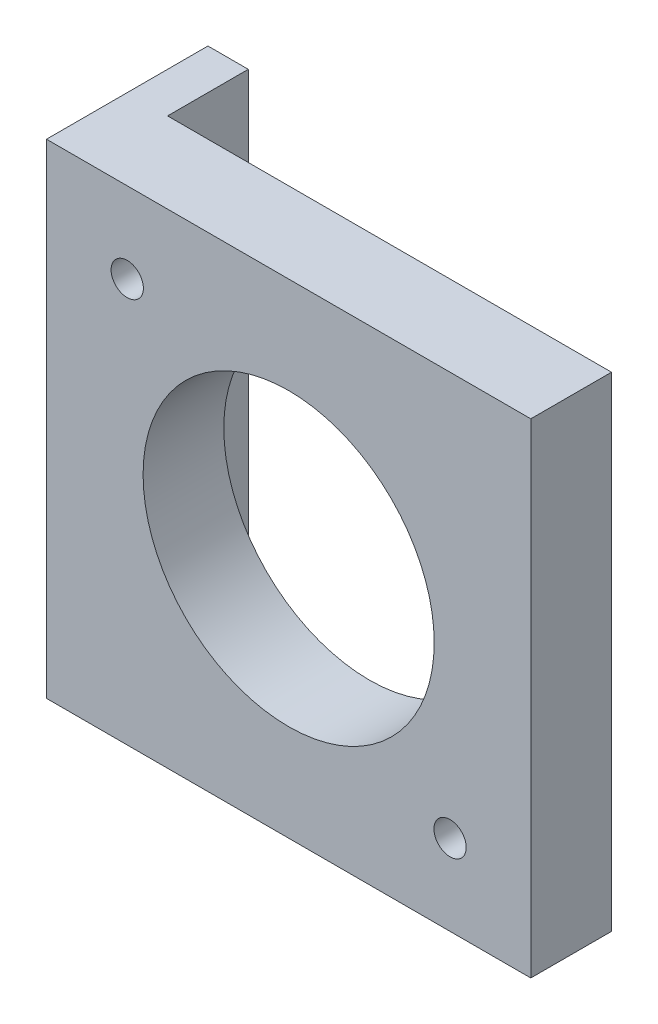
from build123d import *

# Parameters (mm, degrees)
SKETCH1_W           = 60
SKETCH1_H           = 60
BOSS_EXTRUDE1_DEPTH = 10
SKETCH2_R           = 18.034
CUT_EXTRUDE1_DEPTH  = 86.440037453
SKETCH4_W           = 5
SKETCH4_H           = 60
BOSS_EXTRUDE2_DEPTH = 10
SKETCH5_R           = 2
CUT_EXTRUDE3_DEPTH  = 86.440037453
CAVITY3_OUTLINE_R   = 2.5
CAVITY3_DEPTH       = 5
SKETCH7_R           = 2
CUT_EXTRUDE4_DEPTH  = 88.177978871


# Read off the part's stored shape, not the designer's step: Cavity3
with BuildPart() as part:
    # Sketch1 → Boss-Extrude1 (new body)
    with BuildSketch(Plane.XY):
        with Locations((30, 30)):
            Rectangle(SKETCH1_W, SKETCH1_H)
    extrude(amount=BOSS_EXTRUDE1_DEPTH)

    # Sketch2 → Cut-Extrude1 (cut, through all)
    with BuildSketch(Plane(origin=(0, 0, 0), x_dir=(-1, 0, 0), z_dir=(0, 0, -1))):
        with Locations((-30, 30)):
            Circle(SKETCH2_R)
    extrude(amount=-CUT_EXTRUDE1_DEPTH, mode=Mode.SUBTRACT)

    # Sketch4 → Boss-Extrude2 (add)
    with BuildSketch(Plane(origin=(0, 0, 0), x_dir=(-1, 0, 0), z_dir=(0, 0, -1))):
        with Locations((-2.5, 30)):
            Rectangle(SKETCH4_W, SKETCH4_H)
    extrude(amount=BOSS_EXTRUDE2_DEPTH)

    # Sketch5 → Cut-Extrude3 (cut, through all)
    with BuildSketch(Plane.ZY):
        with Locations((-6, 50)):
            Circle(SKETCH5_R)
        with Locations((-6, 10)):
            Circle(SKETCH5_R)
    extrude(amount=-CUT_EXTRUDE3_DEPTH, mode=Mode.SUBTRACT)

    # Cavity3 outline → Cavity3 (cut)
    with BuildSketch(Plane.XY):
        with Locations((10, 10)):
            Circle(CAVITY3_OUTLINE_R)
        with Locations((50, 50)):
            Circle(CAVITY3_OUTLINE_R)
    extrude(amount=CAVITY3_DEPTH, mode=Mode.SUBTRACT)

    # Sketch7 → Cut-Extrude4 (cut, through all)
    with BuildSketch(Plane.XY.offset(10)):
        with Locations((10, 50)):
            Circle(SKETCH7_R)
        with Locations((50, 10)):
            Circle(SKETCH7_R)
    extrude(amount=-CUT_EXTRUDE4_DEPTH, mode=Mode.SUBTRACT)


solid = part.part
